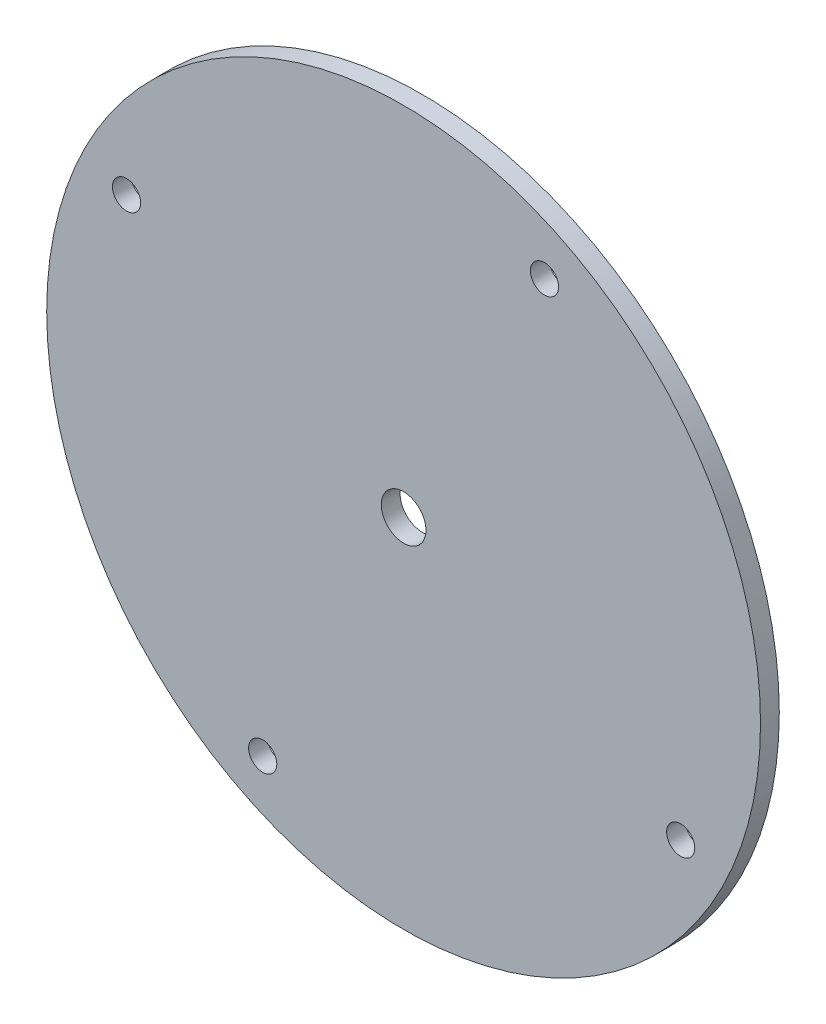
from build123d import *

# Parameters (mm, degrees)
SKETCH1_R           = 76
SKETCH1_R_2         = 3
BOSS_EXTRUDE3_DEPTH = 4
SKETCH2_R           = 4.75
CUT_EXTRUDE1_DEPTH  = 108.554637278


with BuildPart() as part:
    # Sketch1 → Boss-Extrude3 (new body)
    with BuildSketch(Plane.XY):
        Circle(SKETCH1_R)
        with Locations((30, 59)):
            Circle(SKETCH1_R_2, mode=Mode.SUBTRACT)
        with Locations((-30, -59)):
            Circle(SKETCH1_R_2, mode=Mode.SUBTRACT)
        with Locations((59, -30)):
            Circle(SKETCH1_R_2, mode=Mode.SUBTRACT)
        with Locations((-59, 30)):
            Circle(SKETCH1_R_2, mode=Mode.SUBTRACT)
    extrude(amount=BOSS_EXTRUDE3_DEPTH)

    # Sketch2 → Cut-Extrude1 (cut, through all)
    with BuildSketch(Plane.XY.offset(4)):
        Circle(SKETCH2_R)
    extrude(amount=-CUT_EXTRUDE1_DEPTH, mode=Mode.SUBTRACT)


solid = part.part
